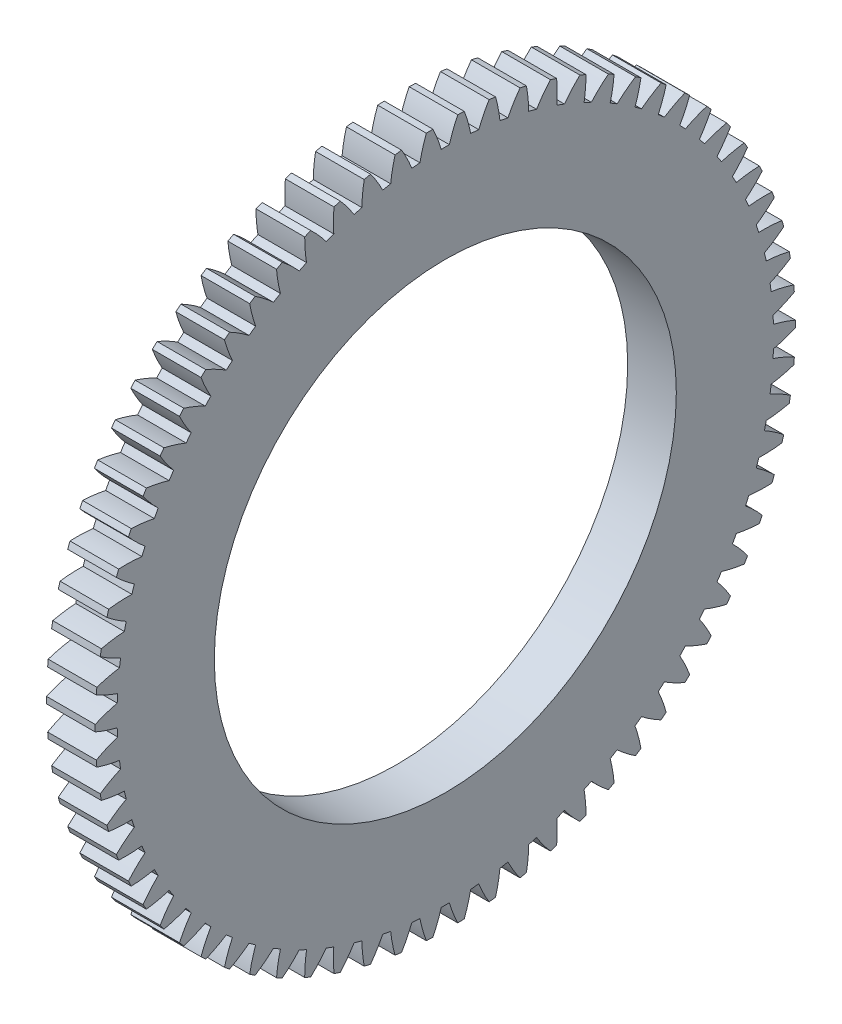
from build123d import *

# Parameters (mm, degrees)
BASPROSKE_W     = 10
BASPROSKE_H     = 72
TOOTHCUT_DEPTH  = 103.313244499
TEETHCUTS_COUNT = 70
TEETHCUTS_ANGLE = 354.857142857
BORSKE_R        = 47.5
BORE_DEPTH      = 50.0000508


with BuildPart() as part:
    # BasProSke → Base-Revolve (revolve)
    with BuildSketch(Plane(origin=(0, 0, 0), x_dir=(1, 0, 0), z_dir=(0, 1, 0))):
        with Locations((5, 36)):
            Rectangle(BASPROSKE_W, BASPROSKE_H)
    revolve(axis=Axis((-10, 0, 0), (1, 0, 0)))

    # TooCutSke → ToothCut (cut, through all)
    with BuildSketch(Plane(origin=(0, 0, 0), x_dir=(0, 0, -1), z_dir=(1, 0, 0))):
        with BuildLine():
            ThreePointArc((0.834496205, 67.493841327), (0, 67.499), (-0.834496205, 67.493841327))
            ThreePointArc((-0.834496205, 67.493841327), (-1.607283563, 69.774040651), (-2.573096918, 71.97942357))
            ThreePointArc((-2.573096918, 71.97942357), (0, 72.0254), (2.573096918, 71.97942357))
            ThreePointArc((2.573096918, 71.97942357), (1.607283563, 69.774040651), (0.834496205, 67.493841327))
        make_face()
    toothcut = extrude(amount=TOOTHCUT_DEPTH, mode=Mode.SUBTRACT)

    # TeethCuts: ToothCut ×70 about axis
    teethcuts_axis = Axis((-10, 0, 0), (1, 0, 0))
    for i in range(1, TEETHCUTS_COUNT):
        add(toothcut.rotate(teethcuts_axis, i * TEETHCUTS_ANGLE / (TEETHCUTS_COUNT - 1)), mode=Mode.SUBTRACT)

    # BorSke → Bore (cut, symmetric)
    with BuildSketch(Plane(origin=(0, 0, 0), x_dir=(0, 0, -1), z_dir=(1, 0, 0))):
        Circle(BORSKE_R)
    extrude(amount=BORE_DEPTH, both=True, mode=Mode.SUBTRACT)


solid = part.part
